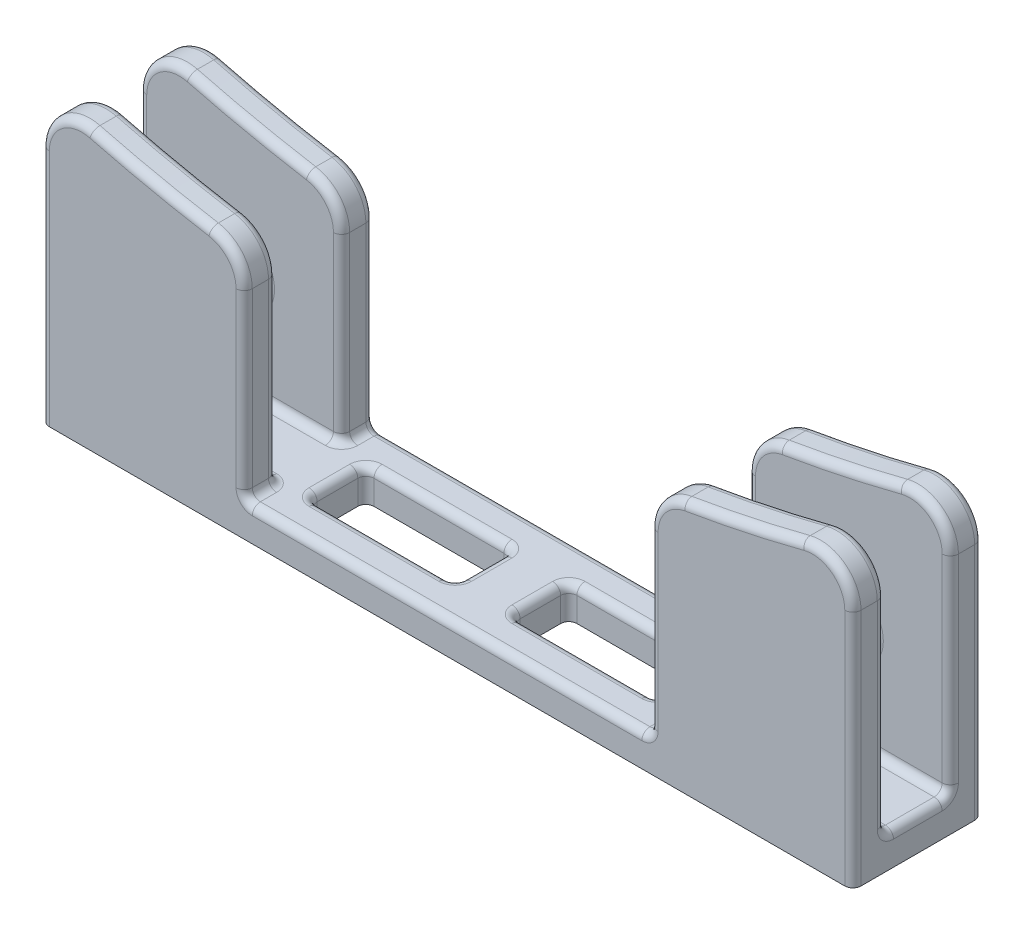
from build123d import *

# Parameters (mm, degrees)
SKETCH1_W            = 100
SKETCH1_H            = 16
BOSS_EXTRUDE1_DEPTH  = 4
SKETCH2_W            = 25
SKETCH2_H            = 4
BOSS_EXTRUDE2_DEPTH  = 32
SKETCH3_R            = 3.75
BOSS_EXTRUDE3_DEPTH  = 1.5
FILLET1_R            = 0.5
CUT_EXTRUDE1_REACH   = 108.958
SKETCH4_R            = 175.282628917
FILLET1_OF_MIRROR3_R = 0.5
FILLET2_R            = 5
SKETCH5_W            = 18
SKETCH5_H            = 7
CUT_EXTRUDE2_DEPTH   = 106.743140061
FILLET5_R            = 1


# Read off the part's stored shape, not the designer's step: Mirror4
with BuildPart() as part:
    # Sketch1 → Boss-Extrude1 (new body)
    with BuildSketch(Plane(origin=(0, 0, 0), x_dir=(1, 0, 0), z_dir=(0, 1, 0))):
        with Locations((50, 8)):
            Rectangle(SKETCH1_W, SKETCH1_H)
    extrude(amount=BOSS_EXTRUDE1_DEPTH)

    # Sketch2 → Boss-Extrude2 (add)
    with BuildSketch(Plane(origin=(0, 4, 0), x_dir=(1, 0, 0), z_dir=(0, 1, 0))):
        with Locations((12.5, 14)):
            Rectangle(SKETCH2_W, SKETCH2_H)
    boss_extrude2 = extrude(amount=BOSS_EXTRUDE2_DEPTH)

    # Sketch3 → Boss-Extrude3 (add)
    with BuildSketch(Plane.XY.offset(-12)):
        with Locations(Location((12.5, 16.5, 0), (0, 0, 180))):
            Circle(SKETCH3_R)
    boss_extrude3 = extrude(amount=BOSS_EXTRUDE3_DEPTH)

    # Fillet1
    fillet1_edges = [part.edges().sort_by_distance(p)[0] for p in [
        (16.25, 16.5, -12),
        (16.25, 16.5, -10.5),
    ]]
    fillet(fillet1_edges, radius=FILLET1_R)

    # Sketch4 → Cut-Extrude1 (cut, up to next)
    with BuildSketch(Plane.XY.offset(-12), mode=Mode.PRIVATE) as cut_extrude1_sk1:
        with Locations((50, 204)):
            Circle(SKETCH4_R)
    cut_extrude1_tool1 = extrude(cut_extrude1_sk1.sketch, amount=-CUT_EXTRUDE1_REACH, mode=Mode.PRIVATE) & part.part
    cut_extrude1 = cut_extrude1_tool1.solids().sort_by_distance((50, 204, -12))[0]
    add(cut_extrude1, mode=Mode.SUBTRACT)

    # Mirror3: Boss-Extrude2, Boss-Extrude3, Cut-Extrude1 across plane
    add(boss_extrude2.mirror(Plane.ZY.offset(-50)))
    add(boss_extrude3.mirror(Plane.ZY.offset(-50)))
    add(cut_extrude1.mirror(Plane.ZY.offset(-50)), mode=Mode.SUBTRACT)

    # Fillet1 of Mirror3
    fillet1_of_mirror3_edges = [part.edges().sort_by_distance(p)[0] for p in [
        (83.75, 16.5, -12),
        (83.75, 16.5, -10.5),
    ]]
    fillet(fillet1_of_mirror3_edges, radius=FILLET1_OF_MIRROR3_R)

    # Mirror4: part across plane


with BuildPart() as part_1:
    add(part.part)
    add(part.part.mirror(Plane.XY.offset(-8)))

    # Fillet2
    fillet2_edges = [part_1.edges().sort_by_distance(p)[0] for p in [
        (25, 30.509366247, -14),
        (0, 36, -14),
        (75, 30.509366247, -14),
        (100, 36, -14),
        (100, 36, -2),
        (75, 30.509366247, -2),
        (25, 30.509366247, -2),
        (0, 36, -2),
    ]]
    fillet(fillet2_edges, radius=FILLET2_R)

    # Sketch5 → Cut-Extrude2 (cut, through all)
    with BuildSketch(Plane(origin=(0, 4, 0), x_dir=(1, 0, 0), z_dir=(0, 1, 0))):
        with Locations((37.5, 8)):
            Rectangle(SKETCH5_W, SKETCH5_H)
        with Locations((62.5, 8)):
            Rectangle(SKETCH5_W, SKETCH5_H)
    extrude(amount=-CUT_EXTRUDE2_DEPTH, mode=Mode.SUBTRACT)

    # Fillet5
    fillet5_edges = [part_1.edges().sort_by_distance(p)[0] for p in [
        (50, 4, 0),
        (12.5, 4, -4),
        (25, 4, -2),
        (0, 4, -8),
        (100, 14.711933391, -16),
        (100, 16.711933391, -12),
        (100, 16.711933391, -4),
        (100, 14.711933391, 0),
        (86.492990798, 32.558285057, -12),
        (75, 15.115487444, -12),
        (76.18161457, 29.458966943, -12),
        (98.062662087, 33.376094122, -12),
        (86.492990798, 32.558285057, -16),
        (0, 14.711933391, -16),
        (13.507009202, 32.558285057, -16),
        (25, 15.115487444, -16),
        (75, 15.115487444, -16),
        (1.937337913, 33.376094122, -16),
        (23.81838543, 29.458966943, -16),
        (76.18161457, 29.458966943, -16),
        (98.062662087, 33.376094122, -16),
        (86.492990798, 32.558285057, 0),
        (86.492990798, 32.558285057, -4),
        (75, 15.115487444, -4),
        (76.18161457, 29.458966943, -4),
        (98.062662087, 33.376094122, -4),
        (13.507009202, 32.558285057, 0),
        (0, 14.711933391, 0),
        (75, 15.115487444, 0),
        (25, 15.115487444, 0),
        (1.937337913, 33.376094122, 0),
        (23.81838543, 29.458966943, 0),
        (12.5, 4, -12),
        (76.18161457, 29.458966943, 0),
        (98.062662087, 33.376094122, 0),
        (13.507009202, 32.558285057, -4),
        (25, 4, -14),
        (0, 16.711933391, -4),
        (25, 15.115487444, -4),
        (1.937337913, 33.376094122, -4),
        (23.81838543, 29.458966943, -4),
        (0, 16.711933391, -12),
        (13.507009202, 32.558285057, -12),
        (25, 15.115487444, -12),
        (1.937337913, 33.376094122, -12),
        (23.81838543, 29.458966943, -12),
        (28.5, 2, -4.5),
        (28.5, 2, -11.5),
        (46.5, 2, -11.5),
        (46.5, 2, -4.5),
        (28.5, 4, -8),
        (37.5, 4, -4.5),
        (46.5, 4, -8),
        (37.5, 4, -11.5),
        (53.5, 2, -11.5),
        (71.5, 2, -11.5),
        (71.5, 2, -4.5),
        (53.5, 2, -4.5),
        (62.5, 4, -11.5),
        (53.5, 4, -8),
        (62.5, 4, -4.5),
        (71.5, 4, -8),
        (50, 4, -16),
        (87.5, 4, -12),
        (75, 4, -14),
        (100, 4, -8),
        (87.5, 4, -4),
        (75, 4, -2),
    ]]
    fillet(fillet5_edges, radius=FILLET5_R)


solid = part_1.part
